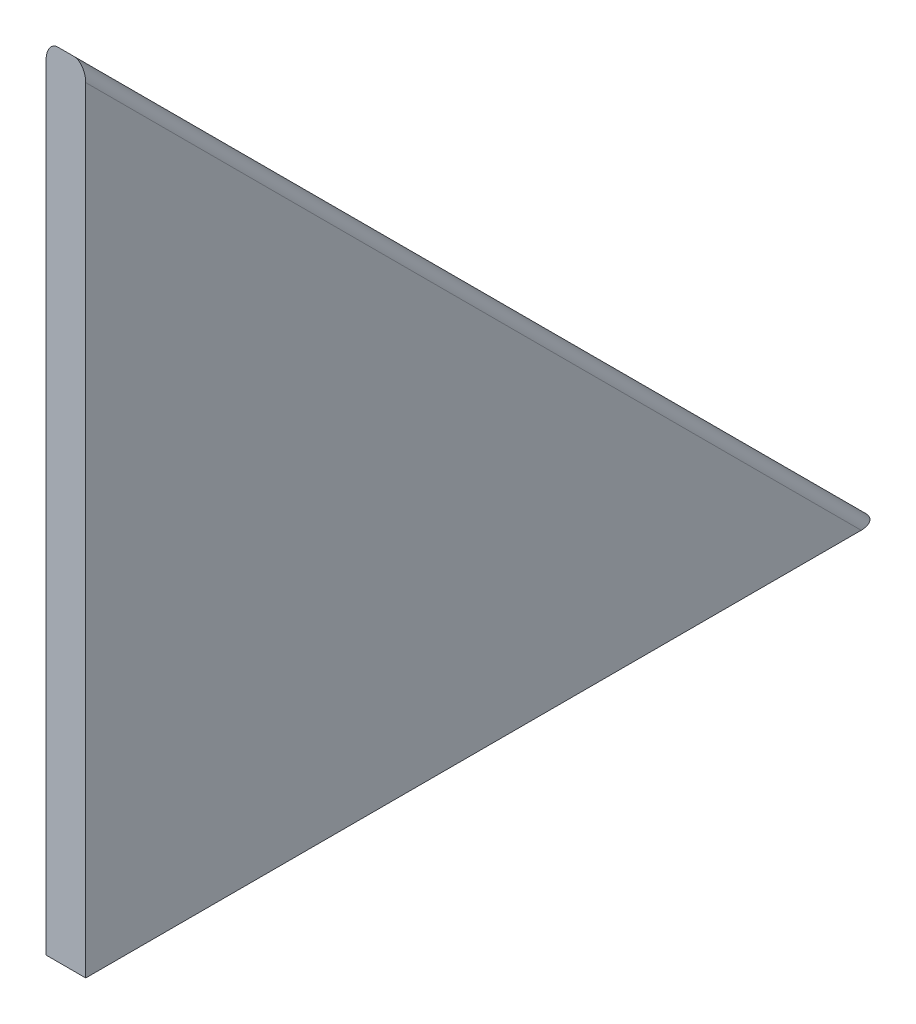
from build123d import *

# Parameters (mm, degrees)
BASE_FLANGE1_DEPTH = 10
FILLET1_R          = 3


# Sheet-metal steps are written as plain solids
with BuildPart() as part:
    # Sketch1 → Base-Flange1 (new body)
    with BuildSketch(Plane(origin=(0, 0, 0), x_dir=(0, 0, -1), z_dir=(1, 0, 0))):
        Polygon((0, 0), (200, -200), (0, -200), align=None)
    extrude(amount=-BASE_FLANGE1_DEPTH)

    # Fillet1
    fillet1_edges = [part.edges().sort_by_distance(p)[0] for p in [
        (-10, -100, -100),
        (0, -100, -100),
    ]]
    fillet(fillet1_edges, radius=FILLET1_R)


solid = part.part
